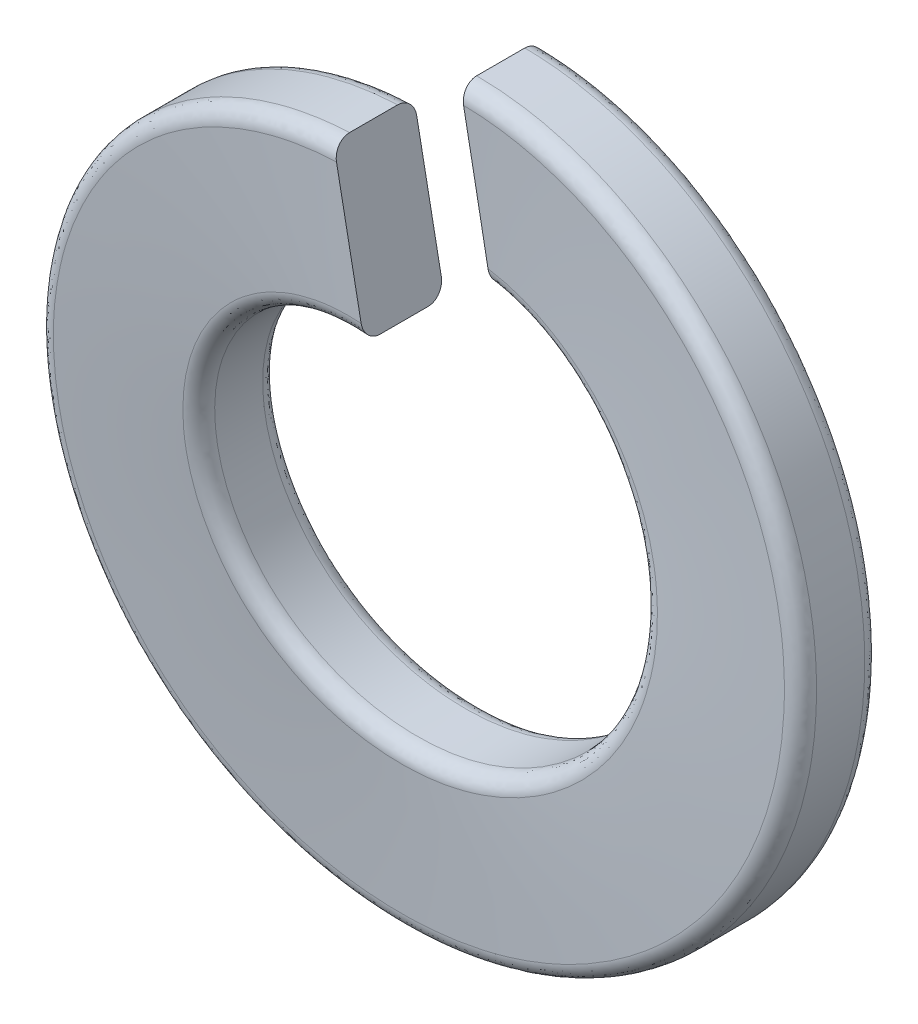
from build123d import *

# Parameters (mm, degrees)
SWEEP1_PITCH       = 0.700700701
CUT_EXTRUDE1_DEPTH = 4.168596061
FILLET1_R          = 0.1


with BuildPart() as part:
    # Sweep1: the profile of Sketch4 screwed along a left-hand helix of 0.999 turns, 6 arcs to a turn; built about Z, then put on its axis
    sweep1_z = Axis((0, 0, 0), (0, 0, 1))
    sweep1_corners = [(2.2, 0, -0.25), (2.2, 0, 0.25), (1.195433638, 0.104586891, 0.25), (1.195433638, 0.104586891, -0.25)]
    with BuildLine(mode=Mode.PRIVATE) as sweep1_profile:
        Line(sweep1_corners[0], sweep1_corners[1])
        Line(sweep1_corners[1], sweep1_corners[2])
        Line(sweep1_corners[2], sweep1_corners[3])
        Line(sweep1_corners[3], sweep1_corners[0])
    sweep1_cap = Face(sweep1_profile.wire())
    sweep1_turn_angles = [0, -30, -60, -90, -120, -150, -180, -210, -240, -270, -300, -329.82, -359.64]
    sweep1_turn_weights = [1, 0.8660254037844387, 1, 0.8660254037844387, 1, 0.8660254037844387, 1, 0.8660254037844387, 1, 0.8660254037844387, 1, 0.8675919238668214, 1]
    sweep1_turn_rails = [Edge.make_bspline([Vector(p[0], p[1], 0).rotate(sweep1_z, sweep1_turn_angles[k]) / sweep1_turn_weights[k] + Vector(0, 0, p[2] + -SWEEP1_PITCH * sweep1_turn_angles[k] / 360) for k in range(13)], [0, 0, 0, 1, 1, 2, 2, 3, 3, 4, 4, 5, 5, 6, 6, 6], 2, sweep1_turn_weights) for p in sweep1_corners]
    sweep1_turn_sides = [Face.make_surface_from_curves(sweep1_turn_rails[p[0]], sweep1_turn_rails[p[1]]) for p in [(0, 1), (1, 2), (2, 3), (3, 0)]]
    sweep1 = Plane(origin=(0, 0, 0.35), x_dir=(-0.08715574274766177, 0.9961946980917452, 0), z_dir=(0, 0, -1)) * Solid(Shell([*sweep1_turn_sides, sweep1_cap, sweep1_cap.rotate(sweep1_z, -359.64).moved(Location((0, 0, -SWEEP1_PITCH * -359.64 / 360)))]))
    add(sweep1)

    # Sketch5 → Cut-Extrude1 (cut, through all)
    with BuildSketch(Plane.XY):
        with BuildLine():
            Line((0, 1.2), (-0.191742634, 2.191628336))
            ThreePointArc((-0.191742634, 2.191628336), (-0.143886884, 2.195289631), (-0.095962652, 2.197906087))
            Line((-0.095962652, 2.197906087), (0.097765203, 1.196010855))
            ThreePointArc((0.097765203, 1.196010855), (0.048923277, 1.199002299), (0, 1.2))
        make_face()
    extrude(amount=-CUT_EXTRUDE1_DEPTH, mode=Mode.SUBTRACT)

    # Fillet1
    fillet1_edges = [part.edges().sort_by_distance(p)[0] for p in [
        (0.143884845, -2.195289765, -0.248130058),
        (0.143884845, -2.195289765, 0.251869942),
        (-0.048929358, -1.199002051, -0.246177966),
        (-0.048929358, -1.199002051, 0.253822034),
    ]]
    fillet(fillet1_edges, radius=FILLET1_R)


solid = part.part
